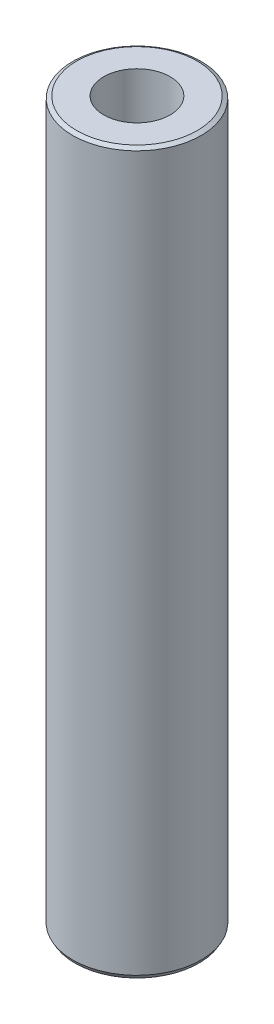
from build123d import *
from OCP.BRepFilletAPI import BRepFilletAPI_MakeChamfer

# Parameters (mm, degrees)
SKETCH1_R           = 35
BOSS_EXTRUDE1_DEPTH = 392.496078714
SKETCH2_R           = 18.088474241
CUT_EXTRUDE1_DEPTH  = 396.604817724
CHAMFER1_SIZE       = 1.237495758
CHAMFER1_SIZE2      = 2.143405527


with BuildPart() as part:
    # Sketch1 → Boss-Extrude1 (new body)
    with BuildSketch(Plane(origin=(0, 0, 0), x_dir=(1, 0, 0), z_dir=(0, 1, 0))):
        Circle(SKETCH1_R)
    extrude(amount=BOSS_EXTRUDE1_DEPTH)

    # Sketch2 → Cut-Extrude1 (cut, through all)
    with BuildSketch(Plane(origin=(0, 0, 0), x_dir=(1, 0, 0), z_dir=(0, 1, 0))):
        Circle(SKETCH2_R)
    extrude(amount=CUT_EXTRUDE1_DEPTH, mode=Mode.SUBTRACT)

    # Chamfer1: one chamfer whose edges measure the first distance from different faces: ONE call of the kernel's chamfer builder (chamfer() names one face for all edges)
    chamfer1_edges_1 = [part.edges().sort_by_distance(p)[0] for p in [
        (-35, 392.496078714, 0),
    ]]
    chamfer1_side_1 = [part.faces().sort_by_distance(p)[0] for p in [
        (-35, 196.248039357, 0),
    ]]
    chamfer1_edges_2 = [part.edges().sort_by_distance(p)[0] for p in [
        (-35, 0, 0),
    ]]
    chamfer1_side_2 = [part.faces().sort_by_distance(p)[0] for p in [
        (-34.010050506, 0, 0),
    ]]
    chamfer1 = BRepFilletAPI_MakeChamfer(part.part.solid().wrapped)
    for e in chamfer1_edges_1:
        chamfer1.Add(CHAMFER1_SIZE, CHAMFER1_SIZE2, e.wrapped, chamfer1_side_1[0].wrapped)  # the first distance lies on this face
    for e in chamfer1_edges_2:
        chamfer1.Add(CHAMFER1_SIZE, CHAMFER1_SIZE2, e.wrapped, chamfer1_side_2[0].wrapped)  # the first distance lies on this face
    add(Compound.cast(chamfer1.Shape()), mode=Mode.REPLACE)


solid = part.part
